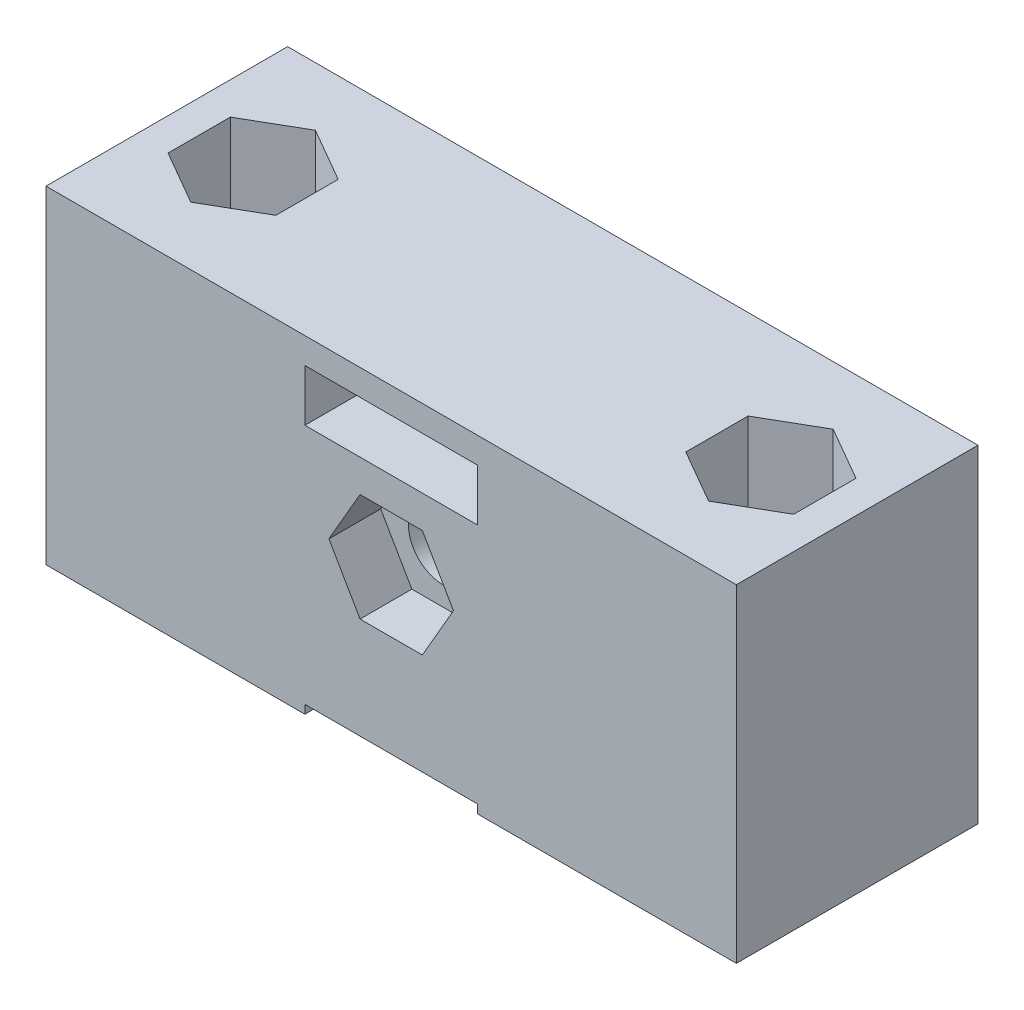
from build123d import *

# Parameters (mm, degrees)
SKETCH1_W           = 40
SKETCH1_H           = 14
BOSS_EXTRUDE1_DEPTH = 19
SKETCH2_W           = 10
SKETCH2_H           = 3
SKETCH2_H_2         = 1
CUT_EXTRUDE1_DEPTH  = 30
SKETCH3_R           = 2
CUT_EXTRUDE2_DEPTH  = 31.935416597
SKETCH4_R           = 1.6
CUT_EXTRUDE3_DEPTH  = 29.460498942
CUT_EXTRUDE4_DEPTH  = 10
CUT_EXTRUDE5_DEPTH  = 3


with BuildPart() as part:
    # Sketch1 → Boss-Extrude1 (new body)
    with BuildSketch(Plane(origin=(0, 0, 0), x_dir=(1, 0, 0), z_dir=(0, 1, 0))):
        Rectangle(SKETCH1_W, SKETCH1_H)
    extrude(amount=BOSS_EXTRUDE1_DEPTH)

    # Sketch2 → Cut-Extrude1 (cut)
    with BuildSketch(Plane.XY.offset(7)):
        with Locations((0, 16)):
            Rectangle(SKETCH2_W, SKETCH2_H)
        Rectangle(SKETCH2_W, SKETCH2_H_2)
    extrude(amount=-CUT_EXTRUDE1_DEPTH, mode=Mode.SUBTRACT)

    # Sketch3 → Cut-Extrude2 (cut, through all)
    with BuildSketch(Plane.XY.offset(7)):
        with Locations((0, 9.5)):
            Circle(SKETCH3_R)
    extrude(amount=-CUT_EXTRUDE2_DEPTH, mode=Mode.SUBTRACT)

    # Sketch4 → Cut-Extrude3 (cut, through all)
    with BuildSketch(Plane(origin=(0, 19, 0), x_dir=(1, 0, 0), z_dir=(0, 1, 0))):
        with Locations((-15, 0)):
            Circle(SKETCH4_R)
        with Locations((15, 0)):
            Circle(SKETCH4_R)
    extrude(amount=-CUT_EXTRUDE3_DEPTH, mode=Mode.SUBTRACT)

    # Sketch9 → Cut-Extrude4 (cut)
    with BuildSketch(Plane(origin=(0, 19, 0), x_dir=(1, 0, 0), z_dir=(0, 1, 0))):
        Polygon((-15, 3.608439182), (-18.125, 1.804219591), (-18.125, -1.804219591), (-15, -3.608439182), (-11.875, -1.804219591), (-11.875, 1.804219591), align=None)
        Polygon((11.875, 1.804219591), (15, 3.608439182), (18.125, 1.804219591), (18.125, -1.804219591), (15, -3.608439182), (11.875, -1.804219591), align=None)
    extrude(amount=-CUT_EXTRUDE4_DEPTH, mode=Mode.SUBTRACT)

    # Sketch10 → Cut-Extrude5 (cut)
    with BuildSketch(Plane.XY.offset(7)):
        Polygon((1.804219591, 12.625), (-1.804219591, 12.625), (-3.608439182, 9.5), (-1.804219591, 6.375), (1.804219591, 6.375), (3.608439182, 9.5), align=None)
    extrude(amount=-CUT_EXTRUDE5_DEPTH, mode=Mode.SUBTRACT)


solid = part.part
